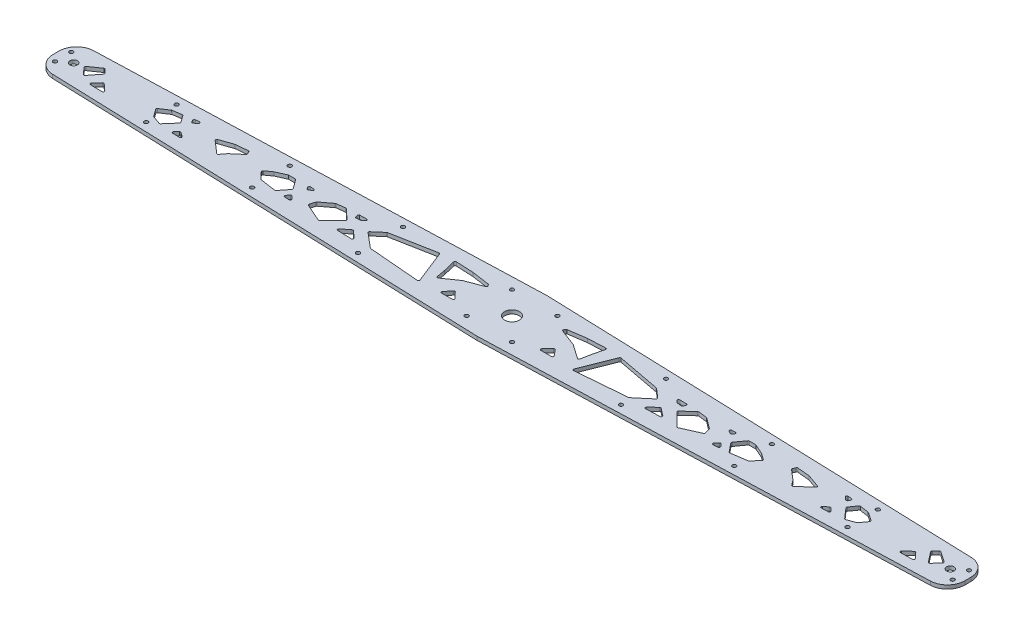
from build123d import *

# Parameters (mm, degrees)
BOSS_EXTRUDE1_DEPTH = 3.18
SKETCH3_R           = 6.35
SKETCH3_R_2         = 3.175
SKETCH3_R_3         = 1.65
CUT_EXTRUDE1_DEPTH  = 392.165070526
CUT_EXTRUDE8_DEPTH  = 392.165070526


with BuildPart() as part:
    # Sketch2 → Boss-Extrude1 (new body)
    with BuildSketch(Plane(origin=(0, 0, 0), x_dir=(1, 0, 0), z_dir=(0, 1, 0))):
        with BuildLine():
            Line((-375, 17.5), (0, 30))
            Line((0, 30), (375, 17.5))
            Line((375, 17.5), (375.499722453, 17.483342585))
            ThreePointArc((375.499722453, 17.483342585), (385.781832794, 12.920095592), (390, 2.49166898))
            Line((390, 2.49166898), (390, -2.49166898))
            ThreePointArc((390, -2.49166898), (385.781832794, -12.920095592), (375.499722453, -17.483342585))
            Line((375.499722453, -17.483342585), (375, -17.5))
            Line((375, -17.5), (0, -30))
            Line((0, -30), (-375, -17.5))
            Line((-375, -17.5), (-375.499722453, -17.483342585))
            ThreePointArc((-375.499722453, -17.483342585), (-385.781832794, -12.920095592), (-390, -2.49166898))
            Line((-390, -2.49166898), (-390, 2.49166898))
            ThreePointArc((-390, 2.49166898), (-385.781832794, 12.920095592), (-375.499722453, 17.483342585))
            Line((-375.499722453, 17.483342585), (-375, 17.5))
        make_face()
    extrude(amount=BOSS_EXTRUDE1_DEPTH)

    # Sketch3 → Cut-Extrude1 (cut, through all)
    with BuildSketch(Plane(origin=(0, 3.18, 0), x_dir=(1, 0, 0), z_dir=(0, 1, 0))):
        Circle(SKETCH3_R)
        with Locations((-375, 0)):
            Circle(SKETCH3_R_2)
        with Locations((-206.25, 16.125)):
            Circle(SKETCH3_R_3)
        with Locations((-112.5, -19.25)):
            Circle(SKETCH3_R_3)
        with Locations((375, 0)):
            Circle(SKETCH3_R_2)
        with Locations((-112.5, 19.25)):
            Circle(SKETCH3_R_3)
        with Locations((-206.25, -16.125)):
            Circle(SKETCH3_R_3)
        with Locations((112.5, -19.25)):
            Circle(SKETCH3_R_3)
        with Locations((112.5, 19.25)):
            Circle(SKETCH3_R_3)
        with Locations((206.25, -16.125)):
            Circle(SKETCH3_R_3)
        with Locations((206.25, 16.125)):
            Circle(SKETCH3_R_3)
        with Locations((-384, 7)):
            Circle(SKETCH3_R_3)
        with Locations((-384, -7)):
            Circle(SKETCH3_R_3)
        with Locations((384, -7)):
            Circle(SKETCH3_R_3)
        with Locations((384, 7)):
            Circle(SKETCH3_R_3)
        with Locations((-19.420687745, 19.420687745)):
            Circle(SKETCH3_R_3)
        with Locations((-19.420687745, -19.420687745)):
            Circle(SKETCH3_R_3)
        with Locations((19.420687745, -19.420687745)):
            Circle(SKETCH3_R_3)
        with Locations((19.420687745, 19.420687745)):
            Circle(SKETCH3_R_3)
        with Locations((-300, 13)):
            Circle(SKETCH3_R_3)
        with Locations((-300, -13)):
            Circle(SKETCH3_R_3)
        with Locations((300, -13)):
            Circle(SKETCH3_R_3)
        with Locations((300, 13)):
            Circle(SKETCH3_R_3)
    extrude(amount=-CUT_EXTRUDE1_DEPTH, mode=Mode.SUBTRACT)

    # Sketch11 → Cut-Extrude8 (cut, through all)
    with BuildSketch(Plane(origin=(0, 3.18, 0), x_dir=(1, 0, 0), z_dir=(0, 1, 0))):
        with BuildLine():
            Line((-46.955749346, -13.254199403), (-37.87504075, -13.254199403))
            ThreePointArc((-37.87504075, -13.254199403), (-36.95455324, -12.644971387), (-37.155639289, -11.559604889))
            Line((-37.155639289, -11.559604889), (-42.067554645, -6.472263986))
            ThreePointArc((-42.067554645, -6.472263986), (-42.827630249, -6.167686035), (-43.560434546, -6.533035888))
            Line((-43.560434546, -6.533035888), (-47.729227786, -11.620376792))
            ThreePointArc((-47.729227786, -11.620376792), (-47.859580804, -12.68208805), (-46.955749346, -13.254199403))
        make_face()
        with BuildLine():
            Line((-59.536816501, -3.515356838), (-47.468549241, 4.898167025))
            ThreePointArc((-47.468549241, 4.898167025), (-47.363497956, 4.962180575), (-47.251381641, 5.012810987))
            Line((-47.251381641, 5.012810987), (-32.914496504, 10.452279602))
            ThreePointArc((-32.914496504, 10.452279602), (-32.313794994, 11.092037289), (-32.44890253, 11.959146368))
            Line((-32.44890253, 11.959146368), (-33.152492574, 12.968368286))
            ThreePointArc((-33.152492574, 12.968368286), (-33.448046335, 13.247713619), (-33.830389761, 13.386275322))
            Line((-33.830389761, 13.386275322), (-49.020035845, 15.571979867))
            ThreePointArc((-49.020035845, 15.571979867), (-49.06816555, 15.57771866), (-49.116516797, 15.58111852))
            Line((-49.116516797, 15.58111852), (-63.942588973, 16.263044091))
            ThreePointArc((-63.942588973, 16.263044091), (-64.760029141, 15.900337127), (-64.960455814, 15.028790273))
            Line((-64.960455814, 15.028790273), (-62.531576105, 4.996583503))
            ThreePointArc((-62.531576105, 4.996583503), (-62.52527538, 4.968839122), (-62.519766476, 4.940926727))
            Line((-62.519766476, 4.940926727), (-61.092444735, -2.874685387))
            ThreePointArc((-61.092444735, -2.874685387), (-60.48952482, -3.619685515), (-59.536816501, -3.515356838))
        make_face()
        with BuildLine():
            Line((-65.867489279, -12.851084643), (-76.818791516, 14.810968515))
            ThreePointArc((-76.818791516, 14.810968515), (-77.266092019, 15.318773143), (-77.93434379, 15.42546359))
            Line((-77.93434379, 15.42546359), (-114.979478259, 8.421844862))
            ThreePointArc((-114.979478259, 8.421844862), (-115.227740664, 8.340150133), (-115.44635537, 8.196916545))
            Line((-115.44635537, 8.196916545), (-123.167009838, 1.546451805))
            ThreePointArc((-123.167009838, 1.546451805), (-123.514354617, 0.783798146), (-123.159419133, 0.024647435))
            Line((-123.159419133, 0.024647435), (-110.862565184, -10.35581369))
            ThreePointArc((-110.862565184, -10.35581369), (-110.599754836, -10.515737447), (-110.300767263, -10.588203424))
            Line((-110.300767263, -10.588203424), (-66.880530036, -14.21571199))
            ThreePointArc((-66.880530036, -14.21571199), (-65.994339866, -13.81524887), (-65.867489279, -12.851084643))
        make_face()
        with BuildLine():
            Line((-138.500363881, -9.512051857), (-132.205638285, -4.609617592))
            ThreePointArc((-132.205638285, -4.609617592), (-131.548188505, -4.399497492), (-130.911222966, -4.665327458))
            Line((-130.911222966, -4.665327458), (-125.244008956, -9.920736989))
            ThreePointArc((-125.244008956, -9.920736989), (-124.998535496, -11.032881643), (-125.953468681, -11.653547063))
            Line((-125.953468681, -11.653547063), (-137.915408287, -11.300571796))
            ThreePointArc((-137.915408287, -11.300571796), (-138.836369454, -10.611864392), (-138.500363881, -9.512051857))
        make_face()
        with BuildLine():
            Line((-139.739839999, 9.466665143), (-133.930891567, 9.592555667))
            ThreePointArc((-133.930891567, 9.592555667), (-132.974208512, 8.947395111), (-133.262475942, 7.83008741))
            Line((-133.262475942, 7.83008741), (-134.995827799, 6.360257908))
            ThreePointArc((-134.995827799, 6.360257908), (-135.241086847, 6.207097438), (-135.519914513, 6.130512433))
            Line((-135.519914513, 6.130512433), (-138.979079647, 5.70297517))
            ThreePointArc((-138.979079647, 5.70297517), (-139.629939754, 5.846302376), (-140.046194638, 6.366776619))
            Line((-140.046194638, 6.366776619), (-140.662626079, 8.138252861))
            ThreePointArc((-140.662626079, 8.138252861), (-140.539462824, 9.037411465), (-139.739839999, 9.466665143))
        make_face()
        with BuildLine():
            Line((-141.869121283, 0.703843181), (-150.293270264, 8.561291761))
            ThreePointArc((-150.293270264, 8.561291761), (-150.668059683, 8.78163118), (-151.100932501, 8.822099584))
            Line((-151.100932501, 8.822099584), (-158.46185294, 7.890337503))
            ThreePointArc((-158.46185294, 7.890337503), (-158.713075968, 7.824547363), (-158.938886877, 7.696286749))
            Line((-158.938886877, 7.696286749), (-167.835601055, 0.978159169))
            ThreePointArc((-167.835601055, 0.978159169), (-168.05379305, 0.751333346), (-168.190677878, 0.467925082))
            Line((-168.190677878, 0.467925082), (-169.532071457, -3.995753156))
            ThreePointArc((-169.532071457, -3.995753156), (-169.482672907, -4.701887684), (-168.978159747, -5.198408239))
            Line((-168.978159747, -5.198408239), (-153.825057905, -11.886351336))
            ThreePointArc((-153.825057905, -11.886351336), (-153.235786306, -11.95414059), (-152.711777672, -11.676199315))
            Line((-152.711777672, -11.676199315), (-141.841702337, -0.7321369))
            ThreePointArc((-141.841702337, -0.7321369), (-141.551385579, -0.00834171), (-141.869121283, 0.703843181))
        make_face()
        with BuildLine():
            Line((-182.755031755, -5.299067981), (-180.579398257, -7.823296737))
            ThreePointArc((-180.579398257, -7.823296737), (-180.443829145, -8.926135869), (-181.410839593, -9.473423661))
            Line((-181.410839593, -9.473423661), (-185.439828424, -9.174588009))
            ThreePointArc((-185.439828424, -9.174588009), (-186.28646803, -8.567815923), (-186.134274883, -7.537375127))
            Line((-186.134274883, -7.537375127), (-184.280919551, -5.311982023))
            ThreePointArc((-184.280919551, -5.311982023), (-183.520967893, -4.951970116), (-182.755031755, -5.299067981))
        make_face()
        with BuildLine():
            Line((-180.487436758, 6.129209035), (-178.34410904, 7.407639798))
            ThreePointArc((-178.34410904, 7.407639798), (-177.88764506, 8.514589055), (-178.82004379, 9.265807153))
            Line((-178.82004379, 9.265807153), (-181.742763405, 9.372060074))
            ThreePointArc((-181.742763405, 9.372060074), (-182.63306088, 8.893046831), (-182.650532608, 7.882216471))
            Line((-182.650532608, 7.882216471), (-181.871140711, 6.497532787))
            ThreePointArc((-181.871140711, 6.497532787), (-181.256931343, 6.02168626), (-180.487436758, 6.129209035))
        make_face()
        with BuildLine():
            Line((-193.789039066, -8.041405278), (-187.852068886, -0.594564861))
            ThreePointArc((-187.852068886, -0.594564861), (-187.634249822, 0.00587827), (-187.824300509, 0.615679742))
            Line((-187.824300509, 0.615679742), (-193.434660528, 8.356209406))
            ThreePointArc((-193.434660528, 8.356209406), (-193.789848688, 8.660094071), (-194.244346721, 8.76934633))
            Line((-194.244346721, 8.76934633), (-199.70292112, 8.76934633))
            ThreePointArc((-199.70292112, 8.76934633), (-199.909407573, 8.74779579), (-200.106994237, 8.68407302))
            Line((-200.106994237, 8.68407302), (-208.420259277, 5.011755427))
            ThreePointArc((-208.420259277, 5.011755427), (-208.514430087, 4.964065639), (-208.603049236, 4.90671493))
            Line((-208.603049236, 4.90671493), (-213.928370429, 1.046905536))
            ThreePointArc((-213.928370429, 1.046905536), (-214.336865254, 0.333462004), (-214.072627838, -0.445029026))
            Line((-214.072627838, -0.445029026), (-208.756796528, -6.141654092))
            ThreePointArc((-208.756796528, -6.141654092), (-208.489458004, -6.345355097), (-208.169728821, -6.448975729))
            Line((-208.169728821, -6.448975729), (-194.715009659, -8.407593757))
            ThreePointArc((-194.715009659, -8.407593757), (-194.203204992, -8.347947697), (-193.789039066, -8.041405278))
        make_face()
        with BuildLine():
            Line((-256.671139357, 4.718751255), (-245.67497638, 8.531374359))
            ThreePointArc((-245.67497638, 8.531374359), (-245.560909702, 8.563492446), (-245.443844553, 8.581891611))
            Line((-245.443844553, 8.581891611), (-235.114669132, 9.582900663))
            ThreePointArc((-235.114669132, 9.582900663), (-234.507333866, 9.447217919), (-234.097843596, 8.978620382))
            Line((-234.097843596, 8.978620382), (-233.190223738, 6.842502951))
            ThreePointArc((-233.190223738, 6.842502951), (-233.137214687, 6.222230535), (-233.461435256, 5.690790178))
            Line((-233.461435256, 5.690790178), (-241.684376578, -1.326788715))
            ThreePointArc((-241.684376578, -1.326788715), (-241.760643057, -1.399139955), (-241.828892701, -1.479097843))
            Line((-241.828892701, -1.479097843), (-245.184318041, -5.856705737))
            ThreePointArc((-245.184318041, -5.856705737), (-245.877859549, -6.24333317), (-246.634530886, -6.002648555))
            Line((-246.634530886, -6.002648555), (-257.000090234, 3.019641763))
            ThreePointArc((-257.000090234, 3.019641763), (-257.325318633, 3.964004117), (-256.671139357, 4.718751255))
        make_face()
        with BuildLine():
            Line((-281.137073769, -8.153694647), (-278.818258184, -5.834879062))
            ThreePointArc((-278.818258184, -5.834879062), (-278.197065936, -5.545683332), (-277.535535613, -5.724265559))
            Line((-277.535535613, -5.724265559), (-273.998540412, -8.214053722))
            ThreePointArc((-273.998540412, -8.214053722), (-273.625321962, -9.34754859), (-274.603340844, -10.031348044))
            Line((-274.603340844, -10.031348044), (-280.459151631, -9.860375466))
            ThreePointArc((-280.459151631, -9.860375466), (-281.359332965, -9.229961123), (-281.137073769, -8.153694647))
        make_face()
        with BuildLine():
            Line((-280.723932944, 9.802625591), (-277.488789213, 10.127315226))
            ThreePointArc((-277.488789213, 10.127315226), (-276.467186027, 9.520118535), (-276.747414613, 8.365201728))
            Line((-276.747414613, 8.365201728), (-279.104707894, 6.393867718))
            ThreePointArc((-279.104707894, 6.393867718), (-279.937308548, 6.179406901), (-280.628653906, 6.690541801))
            Line((-280.628653906, 6.690541801), (-281.506504356, 8.337186176))
            ThreePointArc((-281.506504356, 8.337186176), (-281.506173293, 9.278682803), (-280.723932944, 9.802625591))
        make_face()
        with BuildLine():
            Line((-290.168206163, 8.025157975), (-297.744296977, 6.8636667))
            ThreePointArc((-297.744296977, 6.8636667), (-297.954032467, 6.807674803), (-298.146743207, 6.707741631))
            Line((-298.146743207, 6.707741631), (-305.204875906, 2.011065969))
            ThreePointArc((-305.204875906, 2.011065969), (-305.634726846, 1.357607704), (-305.462686612, 0.594599387))
            Line((-305.462686612, 0.594599387), (-301.147906841, -5.403825691))
            ThreePointArc((-301.147906841, -5.403825691), (-300.937309283, -5.618984629), (-300.672216228, -5.761709442))
            Line((-300.672216228, -5.761709442), (-293.667939867, -8.26130378))
            ThreePointArc((-293.667939867, -8.26130378), (-293.079312884, -8.287070959), (-292.57834751, -7.976942974))
            Line((-292.57834751, -7.976942974), (-285.112364404, 0.57945318))
            ThreePointArc((-285.112364404, 0.57945318), (-284.867009214, 1.188798819), (-285.052655481, 1.818907335))
            Line((-285.052655481, 1.818907335), (-289.203471205, 7.618697534))
            ThreePointArc((-289.203471205, 7.618697534), (-289.628401701, 7.958254589), (-290.168206163, 8.025157975))
        make_face()
        with BuildLine():
            Line((-360.721388989, -4.456205516), (-353.816399288, 4.292749779))
            ThreePointArc((-353.816399288, 4.292749779), (-353.602294182, 4.955196144), (-353.872418696, 5.596841629))
            Line((-353.872418696, 5.596841629), (-356.779527483, 8.692466622))
            ThreePointArc((-356.779527483, 8.692466622), (-357.402501606, 9.002272333), (-358.07677814, 8.830727899))
            Line((-358.07677814, 8.830727899), (-367.037687971, 2.641731163))
            ThreePointArc((-367.037687971, 2.641731163), (-367.461830786, 1.941643396), (-367.221019381, 1.159320012))
            Line((-367.221019381, 1.159320012), (-362.257990463, -4.496263538))
            ThreePointArc((-362.257990463, -4.496263538), (-361.480302142, -4.836336586), (-360.721388989, -4.456205516))
        make_face()
        with BuildLine():
            Line((-352.372806931, -7.394203651), (-347.919490428, -2.485222451))
            ThreePointArc((-347.919490428, -2.485222451), (-347.227457966, -2.158301193), (-346.506948881, -2.416473802))
            Line((-346.506948881, -2.416473802), (-340.919616542, -7.485175085))
            ThreePointArc((-340.919616542, -7.485175085), (-340.661495607, -8.593335713), (-341.607418325, -9.225693685))
            Line((-341.607418325, -9.225693685), (-351.648067167, -9.065973602))
            ThreePointArc((-351.648067167, -9.065973602), (-352.549656155, -8.463848976), (-352.372806931, -7.394203651))
        make_face()
        with BuildLine():
            Line((37.155639289, -11.559604889), (42.067554645, -6.472263986))
            ThreePointArc((42.067554645, -6.472263986), (42.827630249, -6.167686035), (43.560434546, -6.533035888))
            Line((43.560434546, -6.533035888), (47.729227786, -11.620376792))
            ThreePointArc((47.729227786, -11.620376792), (47.859580804, -12.68208805), (46.955749346, -13.254199403))
            Line((46.955749346, -13.254199403), (37.87504075, -13.254199403))
            ThreePointArc((37.87504075, -13.254199403), (36.95455324, -12.644971387), (37.155639289, -11.559604889))
        make_face()
        with BuildLine():
            Line((64.960455814, 15.028790273), (62.531576105, 4.996583503))
            ThreePointArc((62.531576105, 4.996583503), (62.52527538, 4.968839122), (62.519766476, 4.940926727))
            Line((62.519766476, 4.940926727), (61.092444735, -2.874685387))
            ThreePointArc((61.092444735, -2.874685387), (60.48952482, -3.619685515), (59.536816501, -3.515356838))
            Line((59.536816501, -3.515356838), (47.468549241, 4.898167025))
            ThreePointArc((47.468549241, 4.898167025), (47.363497956, 4.962180575), (47.251381641, 5.012810987))
            Line((47.251381641, 5.012810987), (32.914496504, 10.452279602))
            ThreePointArc((32.914496504, 10.452279602), (32.313794994, 11.092037289), (32.44890253, 11.959146368))
            Line((32.44890253, 11.959146368), (33.152492574, 12.968368286))
            ThreePointArc((33.152492574, 12.968368286), (33.448046335, 13.247713619), (33.830389761, 13.386275322))
            Line((33.830389761, 13.386275322), (49.020035845, 15.571979867))
            ThreePointArc((49.020035845, 15.571979867), (49.06816555, 15.57771866), (49.116516797, 15.58111852))
            Line((49.116516797, 15.58111852), (63.942588973, 16.263044091))
            ThreePointArc((63.942588973, 16.263044091), (64.760029141, 15.900337127), (64.960455814, 15.028790273))
        make_face()
        with BuildLine():
            Line((123.159419133, 0.024647435), (110.862565184, -10.35581369))
            ThreePointArc((110.862565184, -10.35581369), (110.599754836, -10.515737447), (110.300767263, -10.588203424))
            Line((110.300767263, -10.588203424), (66.880530036, -14.21571199))
            ThreePointArc((66.880530036, -14.21571199), (65.994339866, -13.81524887), (65.867489279, -12.851084643))
            Line((65.867489279, -12.851084643), (76.818791516, 14.810968515))
            ThreePointArc((76.818791516, 14.810968515), (77.266092019, 15.318773143), (77.93434379, 15.42546359))
            Line((77.93434379, 15.42546359), (114.979478259, 8.421844862))
            ThreePointArc((114.979478259, 8.421844862), (115.227740664, 8.340150133), (115.44635537, 8.196916545))
            Line((115.44635537, 8.196916545), (123.167009838, 1.546451805))
            ThreePointArc((123.167009838, 1.546451805), (123.514354617, 0.783798146), (123.159419133, 0.024647435))
        make_face()
        with BuildLine():
            Line((135.519914513, 6.130512433), (138.979079647, 5.70297517))
            ThreePointArc((138.979079647, 5.70297517), (139.629939754, 5.846302376), (140.046194638, 6.366776619))
            Line((140.046194638, 6.366776619), (140.662626079, 8.138252861))
            ThreePointArc((140.662626079, 8.138252861), (140.539462824, 9.037411465), (139.739839999, 9.466665143))
            Line((139.739839999, 9.466665143), (133.930891567, 9.592555667))
            ThreePointArc((133.930891567, 9.592555667), (132.974208512, 8.947395111), (133.262475942, 7.83008741))
            Line((133.262475942, 7.83008741), (134.995827799, 6.360257908))
            ThreePointArc((134.995827799, 6.360257908), (135.241086847, 6.207097438), (135.519914513, 6.130512433))
        make_face()
        with BuildLine():
            Line((130.911222966, -4.665327458), (125.244008956, -9.920736989))
            ThreePointArc((125.244008956, -9.920736989), (124.998535496, -11.032881643), (125.953468681, -11.653547063))
            Line((125.953468681, -11.653547063), (137.915408287, -11.300571796))
            ThreePointArc((137.915408287, -11.300571796), (138.836369454, -10.611864392), (138.500363881, -9.512051857))
            Line((138.500363881, -9.512051857), (132.205638285, -4.609617592))
            ThreePointArc((132.205638285, -4.609617592), (131.548188505, -4.399497492), (130.911222966, -4.665327458))
        make_face()
        with BuildLine():
            Line((168.978159747, -5.198408239), (153.825057905, -11.886351336))
            ThreePointArc((153.825057905, -11.886351336), (153.235786306, -11.95414059), (152.711777672, -11.676199315))
            Line((152.711777672, -11.676199315), (141.841702337, -0.7321369))
            ThreePointArc((141.841702337, -0.7321369), (141.551385579, -0.00834171), (141.869121283, 0.703843181))
            Line((141.869121283, 0.703843181), (150.293270264, 8.561291761))
            ThreePointArc((150.293270264, 8.561291761), (150.668059683, 8.78163118), (151.100932501, 8.822099584))
            Line((151.100932501, 8.822099584), (158.46185294, 7.890337503))
            ThreePointArc((158.46185294, 7.890337503), (158.713075968, 7.824547363), (158.938886877, 7.696286749))
            Line((158.938886877, 7.696286749), (167.835601055, 0.978159169))
            ThreePointArc((167.835601055, 0.978159169), (168.05379305, 0.751333346), (168.190677878, 0.467925082))
            Line((168.190677878, 0.467925082), (169.532071457, -3.995753156))
            ThreePointArc((169.532071457, -3.995753156), (169.482672907, -4.701887684), (168.978159747, -5.198408239))
        make_face()
        with BuildLine():
            Line((181.871140711, 6.497532787), (182.650532608, 7.882216471))
            ThreePointArc((182.650532608, 7.882216471), (182.63306088, 8.893046831), (181.742763405, 9.372060074))
            Line((181.742763405, 9.372060074), (178.82004379, 9.265807153))
            ThreePointArc((178.82004379, 9.265807153), (177.88764506, 8.514589055), (178.34410904, 7.407639798))
            Line((178.34410904, 7.407639798), (180.487436758, 6.129209035))
            ThreePointArc((180.487436758, 6.129209035), (181.256931343, 6.02168626), (181.871140711, 6.497532787))
        make_face()
        with BuildLine():
            Line((181.410839593, -9.473423661), (185.439828424, -9.174588009))
            ThreePointArc((185.439828424, -9.174588009), (186.28646803, -8.567815923), (186.134274883, -7.537375127))
            Line((186.134274883, -7.537375127), (184.280919551, -5.311982023))
            ThreePointArc((184.280919551, -5.311982023), (183.520967893, -4.951970116), (182.755031755, -5.299067981))
            Line((182.755031755, -5.299067981), (180.579398257, -7.823296737))
            ThreePointArc((180.579398257, -7.823296737), (180.443829145, -8.926135869), (181.410839593, -9.473423661))
        make_face()
        with BuildLine():
            Line((214.072627838, -0.445029026), (208.756796528, -6.141654092))
            ThreePointArc((208.756796528, -6.141654092), (208.489458004, -6.345355097), (208.169728821, -6.448975729))
            Line((208.169728821, -6.448975729), (194.715009659, -8.407593757))
            ThreePointArc((194.715009659, -8.407593757), (194.203204992, -8.347947697), (193.789039066, -8.041405278))
            Line((193.789039066, -8.041405278), (187.852068886, -0.594564861))
            ThreePointArc((187.852068886, -0.594564861), (187.634249822, 0.00587827), (187.824300509, 0.615679742))
            Line((187.824300509, 0.615679742), (193.434660528, 8.356209406))
            ThreePointArc((193.434660528, 8.356209406), (193.789848688, 8.660094071), (194.244346721, 8.76934633))
            Line((194.244346721, 8.76934633), (199.70292112, 8.76934633))
            ThreePointArc((199.70292112, 8.76934633), (199.909407573, 8.74779579), (200.106994237, 8.68407302))
            Line((200.106994237, 8.68407302), (208.420259277, 5.011755427))
            ThreePointArc((208.420259277, 5.011755427), (208.514430087, 4.964065639), (208.603049236, 4.90671493))
            Line((208.603049236, 4.90671493), (213.928370429, 1.046905536))
            ThreePointArc((213.928370429, 1.046905536), (214.336865254, 0.333462004), (214.072627838, -0.445029026))
        make_face()
        with BuildLine():
            Line((241.828892701, -1.479097843), (245.184318041, -5.856705737))
            ThreePointArc((245.184318041, -5.856705737), (245.877859549, -6.24333317), (246.634530886, -6.002648555))
            Line((246.634530886, -6.002648555), (257.000090234, 3.019641763))
            ThreePointArc((257.000090234, 3.019641763), (257.325318633, 3.964004117), (256.671139357, 4.718751255))
            Line((256.671139357, 4.718751255), (245.67497638, 8.531374359))
            ThreePointArc((245.67497638, 8.531374359), (245.560909702, 8.563492446), (245.443844553, 8.581891611))
            Line((245.443844553, 8.581891611), (235.114669132, 9.582900663))
            ThreePointArc((235.114669132, 9.582900663), (234.507333866, 9.447217919), (234.097843596, 8.978620382))
            Line((234.097843596, 8.978620382), (233.190223738, 6.842502951))
            ThreePointArc((233.190223738, 6.842502951), (233.137214687, 6.222230535), (233.461435256, 5.690790178))
            Line((233.461435256, 5.690790178), (241.684376578, -1.326788715))
            ThreePointArc((241.684376578, -1.326788715), (241.760643057, -1.399139955), (241.828892701, -1.479097843))
        make_face()
        with BuildLine():
            Line((276.747414613, 8.365201728), (279.104707894, 6.393867718))
            ThreePointArc((279.104707894, 6.393867718), (279.937308548, 6.179406901), (280.628653906, 6.690541801))
            Line((280.628653906, 6.690541801), (281.506504356, 8.337186176))
            ThreePointArc((281.506504356, 8.337186176), (281.506173293, 9.278682803), (280.723932944, 9.802625591))
            Line((280.723932944, 9.802625591), (277.488789213, 10.127315226))
            ThreePointArc((277.488789213, 10.127315226), (276.467186027, 9.520118535), (276.747414613, 8.365201728))
        make_face()
        with BuildLine():
            Line((277.535535613, -5.724265559), (273.998540412, -8.214053722))
            ThreePointArc((273.998540412, -8.214053722), (273.625321962, -9.34754859), (274.603340844, -10.031348044))
            Line((274.603340844, -10.031348044), (280.459151631, -9.860375466))
            ThreePointArc((280.459151631, -9.860375466), (281.359332965, -9.229961123), (281.137073769, -8.153694647))
            Line((281.137073769, -8.153694647), (278.818258184, -5.834879062))
            ThreePointArc((278.818258184, -5.834879062), (278.197065936, -5.545683332), (277.535535613, -5.724265559))
        make_face()
        with BuildLine():
            Line((292.57834751, -7.976942974), (285.112364404, 0.57945318))
            ThreePointArc((285.112364404, 0.57945318), (284.867009214, 1.188798819), (285.052655481, 1.818907335))
            Line((285.052655481, 1.818907335), (289.203471205, 7.618697534))
            ThreePointArc((289.203471205, 7.618697534), (289.628401701, 7.958254589), (290.168206163, 8.025157975))
            Line((290.168206163, 8.025157975), (297.744296977, 6.8636667))
            ThreePointArc((297.744296977, 6.8636667), (297.954032467, 6.807674803), (298.146743207, 6.707741631))
            Line((298.146743207, 6.707741631), (305.204875906, 2.011065969))
            ThreePointArc((305.204875906, 2.011065969), (305.634726846, 1.357607704), (305.462686612, 0.594599387))
            Line((305.462686612, 0.594599387), (301.147906841, -5.403825691))
            ThreePointArc((301.147906841, -5.403825691), (300.937309283, -5.618984629), (300.672216228, -5.761709442))
            Line((300.672216228, -5.761709442), (293.667939867, -8.26130378))
            ThreePointArc((293.667939867, -8.26130378), (293.079312884, -8.287070959), (292.57834751, -7.976942974))
        make_face()
        with BuildLine():
            Line((358.07677814, 8.830727899), (367.037687971, 2.641731163))
            ThreePointArc((367.037687971, 2.641731163), (367.461830786, 1.941643396), (367.221019381, 1.159320012))
            Line((367.221019381, 1.159320012), (362.257990463, -4.496263538))
            ThreePointArc((362.257990463, -4.496263538), (361.480302142, -4.836336586), (360.721388989, -4.456205516))
            Line((360.721388989, -4.456205516), (353.816399288, 4.292749779))
            ThreePointArc((353.816399288, 4.292749779), (353.602294182, 4.955196144), (353.872418696, 5.596841629))
            Line((353.872418696, 5.596841629), (356.779527483, 8.692466622))
            ThreePointArc((356.779527483, 8.692466622), (357.402501606, 9.002272333), (358.07677814, 8.830727899))
        make_face()
        with BuildLine():
            Line((346.506948881, -2.416473802), (340.919616542, -7.485175085))
            ThreePointArc((340.919616542, -7.485175085), (340.661495607, -8.593335713), (341.607418325, -9.225693685))
            Line((341.607418325, -9.225693685), (351.648067167, -9.065973602))
            ThreePointArc((351.648067167, -9.065973602), (352.549656155, -8.463848976), (352.372806931, -7.394203651))
            Line((352.372806931, -7.394203651), (347.919490428, -2.485222451))
            ThreePointArc((347.919490428, -2.485222451), (347.227457966, -2.158301193), (346.506948881, -2.416473802))
        make_face()
    extrude(amount=-CUT_EXTRUDE8_DEPTH, mode=Mode.SUBTRACT)


solid = part.part
